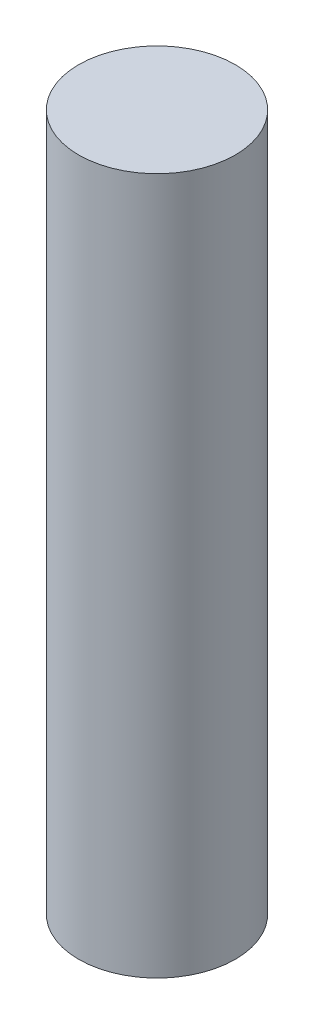
from build123d import *

# Parameters (mm, degrees)
SKETCH1_R           = 12.7
BOSS_EXTRUDE1_DEPTH = 113


with BuildPart() as part:
    # Sketch1 → Boss-Extrude1 (new body)
    with BuildSketch(Plane(origin=(0, 0, 0), x_dir=(1, 0, 0), z_dir=(0, 1, 0))):
        Circle(SKETCH1_R)
    extrude(amount=BOSS_EXTRUDE1_DEPTH)


solid = part.part
